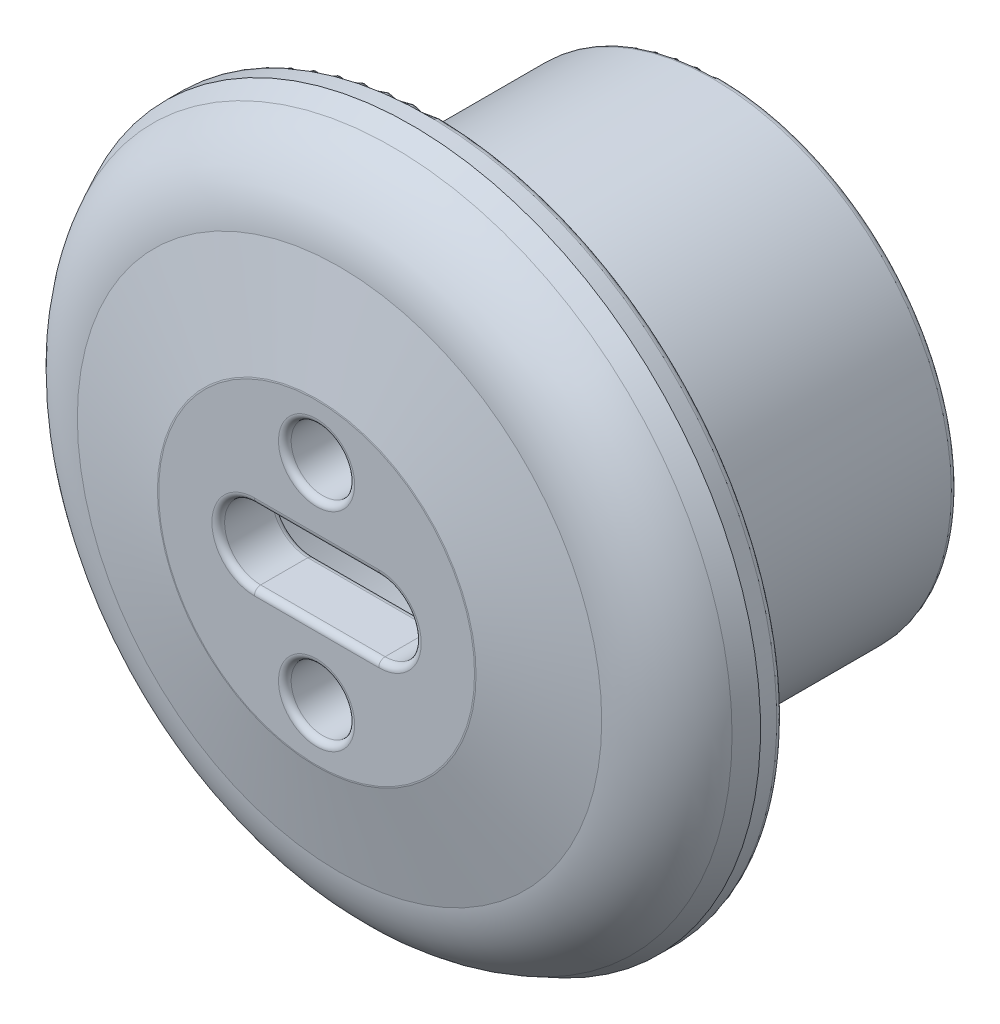
from build123d import *

# Parameters (mm, degrees)
FILLET2_R          = 0.2
SKETCH2_R          = 1
CUT_EXTRUDE1_DEPTH = 10
FILLET3_R          = 0.2


with BuildPart() as part:
    # Sketch1 → Revolve1 (revolve)
    with BuildSketch(Plane(origin=(0, 0, 0), x_dir=(0, 0, -1), z_dir=(1, 0, 0))):
        with BuildLine():
            Line((2.397152395, 10.695987944), (3, 10.99))
            Line((3, 10.99), (3.712206696, 10.99))
            Line((3.712206696, 10.99), (3.712206696, 8.99))
            Line((3.712206696, 8.99), (4.712206696, 8.99))
            Line((4.712206696, 8.99), (4.712206696, 7.49))
            Line((4.712206696, 7.49), (12.712206696, 7.49))
            Line((12.712206696, 7.49), (12.712206696, 6.49))
            Line((12.712206696, 6.49), (3.256669121, 6.49))
            Line((3.256669121, 6.49), (2.882509958, 6.49))
            ThreePointArc((2.882509958, 6.49), (2.175403177, 6.197106781), (1.882509958, 5.49))
            Line((1.882509958, 5.49), (1.882509958, 0))
            Line((1.882509958, 0), (0, 0))
            Line((0, 0), (0, 5))
            Line((0, 5), (0.723761069, 8.262622081))
            ThreePointArc((0.723761069, 8.262622081), (1.240295439, 9.699475411), (2.397152395, 10.695987944))
        make_face()
    revolve(axis=Axis((0, 0, -1.882509958), (0, 0, 1)))

    # Fillet2
    fillet2_edges = [part.edges().sort_by_distance(p)[0] for p in [
        (0, -6.49, -12.712206696),
        (0, -10.99, -3.712206696),
        (0, -8.99, -4.712206696),
        (0, -7.49, -12.712206696),
    ]]
    fillet(fillet2_edges, radius=FILLET2_R)

    # Sketch2 → Cut-Extrude1 (cut)
    with BuildSketch(Plane.XY):
        with Locations((0, 3.274424466)):
            Circle(SKETCH2_R)
        with Locations((0, -3.274424466)):
            Circle(SKETCH2_R)
        with BuildLine():
            Line((-1.959552245, 1.138245181), (1.959552245, 1.138245181))
            ThreePointArc((1.959552245, 1.138245181), (3.097797425, 0), (1.959552245, -1.138245181))
            Line((1.959552245, -1.138245181), (-1.959552245, -1.138245181))
            ThreePointArc((-1.959552245, -1.138245181), (-3.097797425, 0), (-1.959552245, 1.138245181))
        make_face()
    extrude(amount=-CUT_EXTRUDE1_DEPTH, mode=Mode.SUBTRACT)

    # Fillet3
    fillet3_edges = [part.edges().sort_by_distance(p)[0] for p in [
        (0, 1.138245181, -1.882509958),
        (3.097797425, 0, -1.882509958),
        (0, -1.138245181, -1.882509958),
        (-3.097797425, 0, -1.882509958),
        (-1, 3.274424466, -1.882509958),
        (-1, -3.274424466, -1.882509958),
        (0, -5, 0),
        (0, -1.138245181, 0),
        (3.097797425, 0, 0),
        (0, 1.138245181, 0),
        (-3.097797425, 0, 0),
        (-1, 3.274424466, 0),
        (-1, -3.274424466, 0),
    ]]
    fillet(fillet3_edges, radius=FILLET3_R)


solid = part.part
